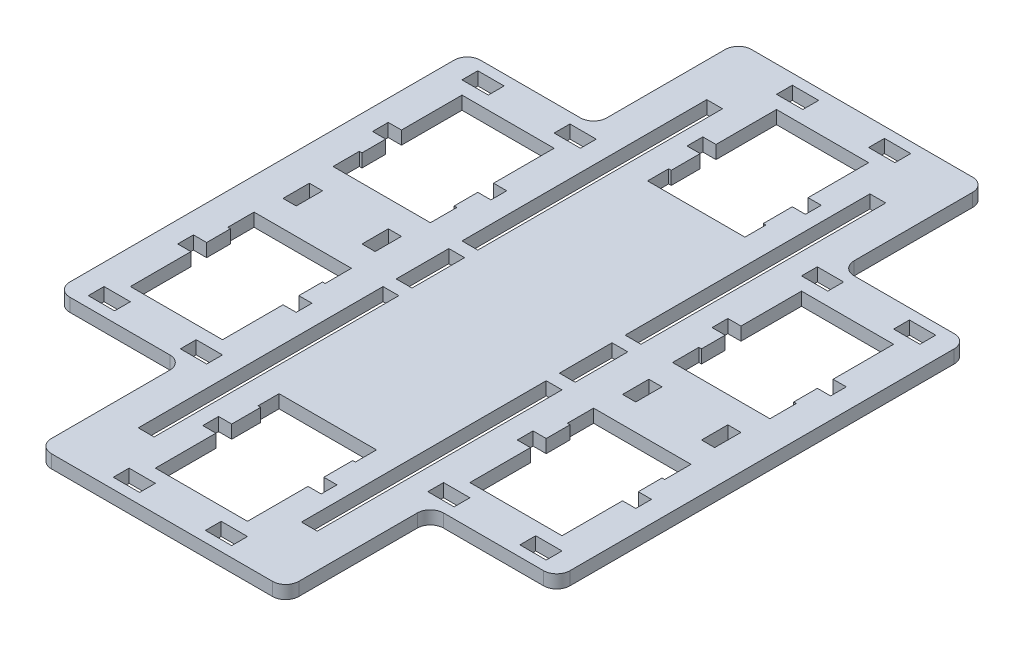
from build123d import *

# Parameters (mm, degrees)
EXTRUDE_1_OUTLINE_W   = 35
EXTRUDE_1_OUTLINE_H   = 48
EXTRUDE_1_OUTLINE_W_2 = 6
EXTRUDE_1_OUTLINE_H_2 = 93
EXTRUDE_1_DEPTH       = 5
FILLET_1_R            = 5
SKETCH_2_W            = 6
SKETCH_2_H            = 20
CUT_EXTRUDE_1_DEPTH   = 247.128015472
SKETCH_3_W            = 5
SKETCH_3_H            = 6
SKETCH_3_W_2          = 5.02388795
SKETCH_3_H_2          = 5.972290287
SKETCH_3_H_3          = 6.000049684
CUT_EXTRUDE_2_DEPTH   = 247.128015472
SKETCH_4_W            = 5
SKETCH_4_H            = 6
SKETCH_4_H_2          = 6.000049684
CUT_EXTRUDE_3_DEPTH   = 247.128015472
SKETCH_5_W            = 5
SKETCH_5_H            = 9.996771353
SKETCH_5_H_2          = 10
CUT_EXTRUDE_4_DEPTH   = 247.128015472
SKETCH_6_W            = 1
SKETCH_6_H            = 10
SKETCH_6_H_2          = 8
CUT_EXTRUDE_5_DEPTH   = 247.128015472


# Read off the part's stored shape, not the designer's step: 凸台-拉伸1
with BuildPart() as part:
    # 凸台-拉伸1 outline → 凸台-拉伸1 (new body)
    with BuildSketch(Plane(origin=(0, 0, 0), x_dir=(1, 0, 0), z_dir=(0, 1, 0))):
        Polygon((95, 172), (47, 172), (47, 227), (-47, 227), (-47, 172), (-95, 172), (-95, 16), (-47, 16), (-47, -39), (47, -39), (47, 16), (95, 16), align=None)
        with Locations((-64.5, 55)):
            Rectangle(EXTRUDE_1_OUTLINE_W, EXTRUDE_1_OUTLINE_H, mode=Mode.SUBTRACT)
        with Locations((-31, 32.5)):
            Rectangle(EXTRUDE_1_OUTLINE_W_2, EXTRUDE_1_OUTLINE_H_2, mode=Mode.SUBTRACT)
        Rectangle(EXTRUDE_1_OUTLINE_W, EXTRUDE_1_OUTLINE_H, mode=Mode.SUBTRACT)
        with Locations((31, 32.5)):
            Rectangle(EXTRUDE_1_OUTLINE_W_2, EXTRUDE_1_OUTLINE_H_2, mode=Mode.SUBTRACT)
        with Locations((64.5, 55)):
            Rectangle(EXTRUDE_1_OUTLINE_W, EXTRUDE_1_OUTLINE_H, mode=Mode.SUBTRACT)
        with Locations((-64.5, 133)):
            Rectangle(EXTRUDE_1_OUTLINE_W, EXTRUDE_1_OUTLINE_H, mode=Mode.SUBTRACT)
        with Locations((-31, 155.5)):
            Rectangle(EXTRUDE_1_OUTLINE_W_2, EXTRUDE_1_OUTLINE_H_2, mode=Mode.SUBTRACT)
        with Locations((31, 155.5)):
            Rectangle(EXTRUDE_1_OUTLINE_W_2, EXTRUDE_1_OUTLINE_H_2, mode=Mode.SUBTRACT)
        with Locations((64.5, 133)):
            Rectangle(EXTRUDE_1_OUTLINE_W, EXTRUDE_1_OUTLINE_H, mode=Mode.SUBTRACT)
        with Locations((0, 188)):
            Rectangle(EXTRUDE_1_OUTLINE_W, EXTRUDE_1_OUTLINE_H, mode=Mode.SUBTRACT)
    extrude(amount=EXTRUDE_1_DEPTH)

    # 圆角1
    fillet_1_edges = [part.edges().sort_by_distance(p)[0] for p in [
        (-95, 2.5, -172),
        (-95, 2.5, -16),
        (95, 2.5, -172),
        (95, 2.5, -16),
        (47, 2.5, -172),
        (47, 2.5, -16),
        (47, 2.5, 39),
        (-47, 2.5, 39),
        (-47, 2.5, -16),
        (-47, 2.5, -172),
        (-47, 2.5, -227),
        (47, 2.5, -227),
    ]]
    fillet(fillet_1_edges, radius=FILLET_1_R)

    # 草图2 → 切除-拉伸1 (cut, through all)
    with BuildSketch(Plane(origin=(0, 5, 0), x_dir=(1, 0, 0), z_dir=(0, 1, 0))):
        with Locations((-31, 94)):
            Rectangle(SKETCH_2_W, SKETCH_2_H)
        with Locations((31, 94)):
            Rectangle(SKETCH_2_W, SKETCH_2_H)
    extrude(amount=-CUT_EXTRUDE_1_DEPTH, mode=Mode.SUBTRACT)

    # 草图3 → 切除-拉伸2 (cut, through all)
    with BuildSketch(Plane.XZ):
        with Locations((-20, 32)):
            Rectangle(SKETCH_3_W, SKETCH_3_H)
        with Locations((20, 32)):
            Rectangle(SKETCH_3_W, SKETCH_3_H)
        with Locations((20, -2)):
            Rectangle(SKETCH_3_W, SKETCH_3_H)
        with Locations((84.5, -23)):
            Rectangle(SKETCH_3_W, SKETCH_3_H)
        with Locations((84.511943975, -56.986145144)):
            Rectangle(SKETCH_3_W_2, SKETCH_3_H_2)
        with Locations((44.5, -23.000024842)):
            Rectangle(SKETCH_3_W, SKETCH_3_H_3)
        with Locations((44.5, -57.000049684)):
            Rectangle(SKETCH_3_W, SKETCH_3_H)
        with Locations((-44.5, -57.000049684)):
            Rectangle(SKETCH_3_W, SKETCH_3_H)
        with Locations((-84.511943975, -56.986145144)):
            Rectangle(SKETCH_3_W_2, SKETCH_3_H_2)
        with Locations((-84.5, -23)):
            Rectangle(SKETCH_3_W, SKETCH_3_H)
        with Locations((-44.5, -23.000024842)):
            Rectangle(SKETCH_3_W, SKETCH_3_H_3)
        with Locations((-44.5, -164.999975158)):
            Rectangle(SKETCH_3_W, SKETCH_3_H_3)
        with Locations((-84.5, -165)):
            Rectangle(SKETCH_3_W, SKETCH_3_H)
        with Locations((-84.511943975, -131.013854857)):
            Rectangle(SKETCH_3_W_2, SKETCH_3_H_2)
        with Locations((-44.5, -130.999950316)):
            Rectangle(SKETCH_3_W, SKETCH_3_H)
        with Locations((44.5, -130.999950316)):
            Rectangle(SKETCH_3_W, SKETCH_3_H)
        with Locations((44.5, -164.999975158)):
            Rectangle(SKETCH_3_W, SKETCH_3_H_3)
        with Locations((84.511943975, -131.013854857)):
            Rectangle(SKETCH_3_W_2, SKETCH_3_H_2)
        with Locations((84.5, -165)):
            Rectangle(SKETCH_3_W, SKETCH_3_H)
        with Locations((20, -186)):
            Rectangle(SKETCH_3_W, SKETCH_3_H)
        with Locations((20, -220)):
            Rectangle(SKETCH_3_W, SKETCH_3_H)
        with Locations((-20, -220)):
            Rectangle(SKETCH_3_W, SKETCH_3_H)
        with Locations((-20, -2)):
            Rectangle(SKETCH_3_W, SKETCH_3_H)
        with Locations((-20, -186)):
            Rectangle(SKETCH_3_W, SKETCH_3_H)
    extrude(amount=-CUT_EXTRUDE_2_DEPTH, mode=Mode.SUBTRACT)

    # 草图4 → 切除-拉伸3 (cut, through all)
    with BuildSketch(Plane(origin=(0, 5, 0), x_dir=(1, 0, 0), z_dir=(0, 1, 0))):
        with Locations((-15, -32)):
            Rectangle(SKETCH_4_W, SKETCH_4_H)
        with Locations((-49.5, 23.000024842)):
            Rectangle(SKETCH_4_W, SKETCH_4_H_2)
        with Locations((-79.5, 23)):
            Rectangle(SKETCH_4_W, SKETCH_4_H)
        with Locations((79.5, 23)):
            Rectangle(SKETCH_4_W, SKETCH_4_H)
        with Locations((49.5, 23.000024842)):
            Rectangle(SKETCH_4_W, SKETCH_4_H_2)
        with Locations((15, -32)):
            Rectangle(SKETCH_4_W, SKETCH_4_H)
        with Locations((15, 220)):
            Rectangle(SKETCH_4_W, SKETCH_4_H)
        with Locations((-79.5, 165)):
            Rectangle(SKETCH_4_W, SKETCH_4_H)
        with Locations((-49.5, 164.999975158)):
            Rectangle(SKETCH_4_W, SKETCH_4_H_2)
        with Locations((-15, 220)):
            Rectangle(SKETCH_4_W, SKETCH_4_H)
        with Locations((49.5, 164.999975158)):
            Rectangle(SKETCH_4_W, SKETCH_4_H_2)
        with Locations((79.5, 165)):
            Rectangle(SKETCH_4_W, SKETCH_4_H)
    extrude(amount=-CUT_EXTRUDE_3_DEPTH, mode=Mode.SUBTRACT)

    # 草图5 → 切除-拉伸4 (cut, through all)
    with BuildSketch(Plane.XZ):
        with Locations((49.5, -94.001614324)):
            Rectangle(SKETCH_5_W, SKETCH_5_H)
        with Locations((-49.5, -94.001614324)):
            Rectangle(SKETCH_5_W, SKETCH_5_H)
        with Locations((79.5, -94)):
            Rectangle(SKETCH_5_W, SKETCH_5_H_2)
        with Locations((-79.5, -94)):
            Rectangle(SKETCH_5_W, SKETCH_5_H_2)
    extrude(amount=-CUT_EXTRUDE_4_DEPTH, mode=Mode.SUBTRACT)

    # 草图6 → 切除-拉伸5 (cut, through all)
    with BuildSketch(Plane(origin=(0, 5, 0), x_dir=(1, 0, 0), z_dir=(0, 1, 0))):
        with Locations((-82.5, 114)):
            Rectangle(SKETCH_6_W, SKETCH_6_H)
        with Locations((-46.5, 114)):
            Rectangle(SKETCH_6_W, SKETCH_6_H)
        with Locations((-18, 168)):
            Rectangle(SKETCH_6_W, SKETCH_6_H_2)
        with Locations((18, 168)):
            Rectangle(SKETCH_6_W, SKETCH_6_H_2)
        with Locations((46.5, 114)):
            Rectangle(SKETCH_6_W, SKETCH_6_H)
        with Locations((82.5, 114)):
            Rectangle(SKETCH_6_W, SKETCH_6_H)
        with Locations((82.5, 74)):
            Rectangle(SKETCH_6_W, SKETCH_6_H)
        with Locations((46.5, 74)):
            Rectangle(SKETCH_6_W, SKETCH_6_H)
        with Locations((18, 20)):
            Rectangle(SKETCH_6_W, SKETCH_6_H_2)
        with Locations((-18, 20)):
            Rectangle(SKETCH_6_W, SKETCH_6_H_2)
        with Locations((-46.5, 74)):
            Rectangle(SKETCH_6_W, SKETCH_6_H)
        with Locations((-82.5, 74)):
            Rectangle(SKETCH_6_W, SKETCH_6_H)
    extrude(amount=-CUT_EXTRUDE_5_DEPTH, mode=Mode.SUBTRACT)


solid = part.part
